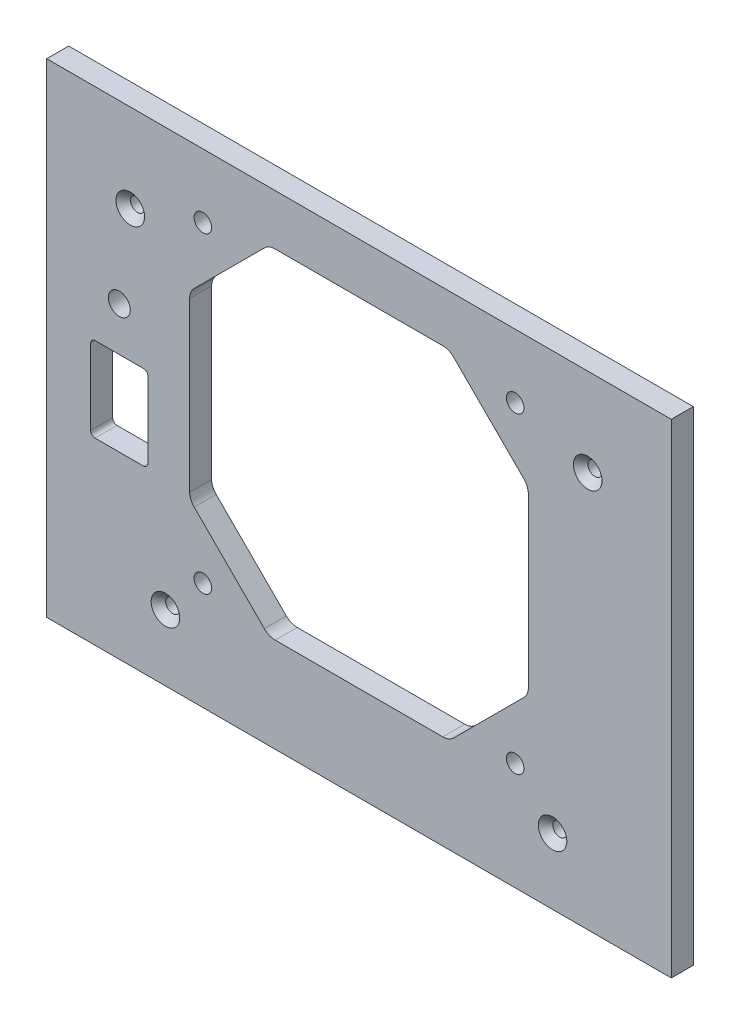
from build123d import *

# Parameters (mm, degrees)
SKETCH1_W                              = 142
SKETCH1_H                              = 110
SHEET_DEPTH                            = 2.5
SKETCH7_R                              = 2
FANHOLES_DEPTH                         = 90.949986103
FILLET1_R                              = 3.5
F_3_2_3_2_TOPMOUNTHOLES_D              = 3.2
F_3_2_3_2_TOPMOUNTHOLES_CSINK_D        = 6.5
F_3_2_3_2_TOPMOUNTHOLES_CSINK_ANGLE    = 90
F_3_2_3_2_BOTTOMMOUNTHOLES_D           = 3.2
F_3_2_3_2_BOTTOMMOUNTHOLES_CSINK_D     = 6.5
F_3_2_3_2_BOTTOMMOUNTHOLES_CSINK_ANGLE = 90
SWITCHSLOT_DEPTH                       = 90.949986103
SKETCH8_R                              = 2.5
LEDHOLE_DEPTH                          = 90.949986103


with BuildPart() as part:
    # Sketch1 → Sheet (new, symmetric)
    with BuildSketch(Plane.XY):
        Rectangle(SKETCH1_W, SKETCH1_H)
    extrude(amount=SHEET_DEPTH, both=True)

    # Sketch7 → FanHoles (cut, through all)
    with BuildSketch(Plane.XY.offset(2.5)):
        with Locations((-35.5, -30.5)):
            Circle(SKETCH7_R)
        with Locations((35.5, -30.5)):
            Circle(SKETCH7_R)
        with Locations((35.5, 40.5)):
            Circle(SKETCH7_R)
        with Locations((-35.5, 40.5)):
            Circle(SKETCH7_R)
        Polygon((-20.5, 43.5), (-38.5, 25.5), (-38.5, -15.5), (-20.5, -33.5), (20.5, -33.5), (38.5, -15.5), (38.5, 25.5), (20.5, 43.5), align=None)
    extrude(amount=-FANHOLES_DEPTH, mode=Mode.SUBTRACT)

    # Fillet1
    fillet1_edges = [part.edges().sort_by_distance(p)[0] for p in [
        (38.5, 25.5, 0),
        (38.5, -15.5, 0),
        (20.5, -33.5, 0),
        (-38.5, -15.5, 0),
        (-38.5, 25.5, 0),
        (-20.5, 43.5, 0),
        (20.5, 43.5, 0),
        (-20.5, -33.5, 0),
    ]]
    fillet(fillet1_edges, radius=FILLET1_R)

    # Ø3.2 (3.2) TopMountHoles (through all)
    with Locations(Plane.XY.offset(2.5)):
        with Locations((-52, 35), (52, 35)):
            CounterSinkHole(F_3_2_3_2_TOPMOUNTHOLES_D / 2, F_3_2_3_2_TOPMOUNTHOLES_CSINK_D / 2, counter_sink_angle=F_3_2_3_2_TOPMOUNTHOLES_CSINK_ANGLE)

    # Ø3.2 (3.2) BottomMountHoles (through all)
    with Locations(Plane.XY.offset(2.5)):
        with Locations((-44, -40), (44, -40)):
            CounterSinkHole(F_3_2_3_2_BOTTOMMOUNTHOLES_D / 2, F_3_2_3_2_BOTTOMMOUNTHOLES_CSINK_D / 2, counter_sink_angle=F_3_2_3_2_BOTTOMMOUNTHOLES_CSINK_ANGLE)

    # Sketch13 → SwitchSlot (cut, through all)
    with BuildSketch(Plane.XY.offset(2.5)):
        with BuildLine():
            Line((-60, 5), (-49, 5))
            ThreePointArc((-49, 5), (-48.292893219, 4.707106781), (-48, 4))
            Line((-48, 4), (-48, -13.2))
            ThreePointArc((-48, -13.2), (-48.292893219, -13.907106781), (-49, -14.2))
            Line((-49, -14.2), (-60, -14.2))
            ThreePointArc((-60, -14.2), (-60.707106781, -13.907106781), (-61, -13.2))
            Line((-61, -13.2), (-61, 4))
            ThreePointArc((-61, 4), (-60.707106781, 4.707106781), (-60, 5))
        make_face()
    extrude(amount=-SWITCHSLOT_DEPTH, mode=Mode.SUBTRACT)

    # Sketch8 → LEDHole (cut, through all)
    with BuildSketch(Plane.XY.offset(2.5)):
        with Locations((-54.5, 15)):
            Circle(SKETCH8_R)
    extrude(amount=-LEDHOLE_DEPTH, mode=Mode.SUBTRACT)


solid = part.part
